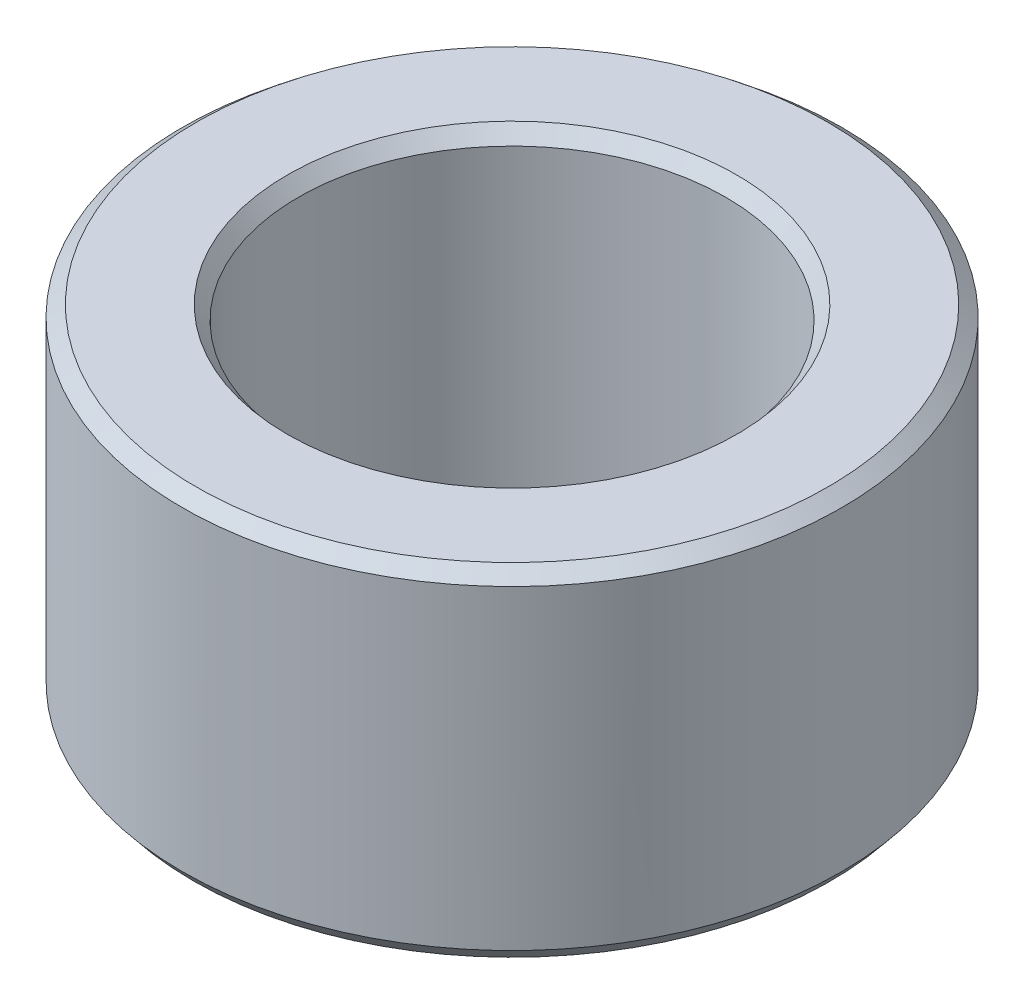
from build123d import *
from OCP.BRepFilletAPI import BRepFilletAPI_MakeChamfer

# Parameters (mm, degrees)
SKETCH1_R           = 57.5
BOSS_EXTRUDE1_DEPTH = 59.330539166
SKETCH2_R           = 37.263545161
CUT_EXTRUDE1_DEPTH  = 101.660880573
CHAMFER1_SIZE       = 1.946503868
CHAMFER1_SIZE2      = 2.390047318


with BuildPart() as part:
    # Sketch1 → Boss-Extrude1 (new body)
    with BuildSketch(Plane(origin=(0, 0, 0), x_dir=(1, 0, 0), z_dir=(0, 1, 0))):
        Circle(SKETCH1_R)
    extrude(amount=BOSS_EXTRUDE1_DEPTH)

    # Sketch2 → Cut-Extrude1 (cut, through all)
    with BuildSketch(Plane(origin=(0, 0, 0), x_dir=(1, 0, 0), z_dir=(0, 1, 0))):
        Circle(SKETCH2_R)
    extrude(amount=CUT_EXTRUDE1_DEPTH, mode=Mode.SUBTRACT)

    # Chamfer1: one chamfer whose edges measure the first distance from different faces: ONE call of the kernel's chamfer builder (chamfer() names one face for all edges)
    chamfer1_edges_1 = [part.edges().sort_by_distance(p)[0] for p in [
        (-37.263545161, 59.330539166, 0),
    ]]
    chamfer1_side_1 = [part.faces().sort_by_distance(p)[0] for p in [
        (-55.873654403, 59.330539166, 0),
    ]]
    chamfer1_edges_2 = [part.edges().sort_by_distance(p)[0] for p in [
        (-37.263545161, 0, 0),
    ]]
    chamfer1_side_2 = [part.faces().sort_by_distance(p)[0] for p in [
        (-37.263545161, 29.665269583, 0),
    ]]
    chamfer1_edges_3 = [part.edges().sort_by_distance(p)[0] for p in [
        (-57.5, 0, 0),
    ]]
    chamfer1_side_3 = [part.faces().sort_by_distance(p)[0] for p in [
        (-55.873654403, 0, 0),
    ]]
    chamfer1_edges_4 = [part.edges().sort_by_distance(p)[0] for p in [
        (-57.5, 59.330539166, 0),
    ]]
    chamfer1_side_4 = [part.faces().sort_by_distance(p)[0] for p in [
        (-57.5, 29.665269583, 0),
    ]]
    chamfer1 = BRepFilletAPI_MakeChamfer(part.part.solid().wrapped)
    for e in chamfer1_edges_1:
        chamfer1.Add(CHAMFER1_SIZE, CHAMFER1_SIZE2, e.wrapped, chamfer1_side_1[0].wrapped)  # the first distance lies on this face
    for e in chamfer1_edges_2:
        chamfer1.Add(CHAMFER1_SIZE, CHAMFER1_SIZE2, e.wrapped, chamfer1_side_2[0].wrapped)  # the first distance lies on this face
    for e in chamfer1_edges_3:
        chamfer1.Add(CHAMFER1_SIZE, CHAMFER1_SIZE2, e.wrapped, chamfer1_side_3[0].wrapped)  # the first distance lies on this face
    for e in chamfer1_edges_4:
        chamfer1.Add(CHAMFER1_SIZE, CHAMFER1_SIZE2, e.wrapped, chamfer1_side_4[0].wrapped)  # the first distance lies on this face
    add(Compound.cast(chamfer1.Shape()), mode=Mode.REPLACE)


solid = part.part
